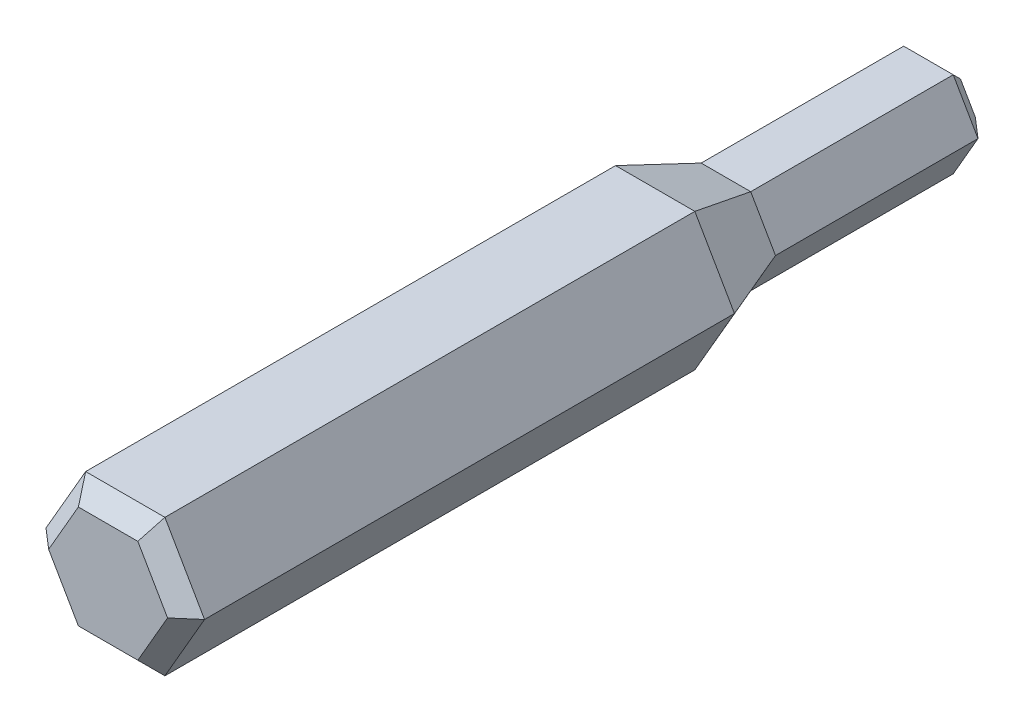
from build123d import *

# Parameters (mm, degrees)
EXTRUDE_1_DEPTH  = 18
CHAMFER_1_SIZE   = 0.5
EXTRUDE_2_DEPTH  = 6.4
CHAMFER_3_SIZE   = 0.75
CHAMFER_3_SIZE_2 = 2.060608065
CHAMFER_4_SIZE   = 0.5


with BuildPart() as part:
    # 草图1 → 凸台-拉伸1 (new body)
    with BuildSketch(Plane.XY):
        Polygon((2.309401077, 0), (1.154700538, 2), (-1.154700538, 2), (-2.309401077, 0), (-1.154700538, -2), (1.154700538, -2), align=None)
    extrude(amount=EXTRUDE_1_DEPTH)

    # 倒角1
    chamfer_1_edges = [part.edges().sort_by_distance(p)[0] for p in [
        (0, 2, 18),
        (-1.732050808, 1, 18),
        (-1.732050808, -1, 18),
        (0, -2, 18),
        (1.732050808, -1, 18),
        (1.732050808, 1, 18),
    ]]
    chamfer(chamfer_1_edges, length=CHAMFER_1_SIZE)

    # 草图2 → 凸台-拉伸2 (add)
    with BuildSketch(Plane(origin=(0, 0, 0), x_dir=(-1, 0, 0), z_dir=(0, 0, -1))):
        Polygon((1.443375673, 0), (0.721687836, 1.25), (-0.721687836, 1.25), (-1.443375673, 0), (-0.721687836, -1.25), (0.721687836, -1.25), align=None)
    extrude(amount=EXTRUDE_2_DEPTH)

    # 倒角3
    # the kernel refuses this chamfer: 2.060608065, 0.75 mm, written as the material it takes off along each edge
    with BuildSketch(Plane(origin=(-6.500319125, -2, 0), x_dir=(-1.0524294974817634e-14, 0.9950833631817486, -0.09904090225205059), z_dir=(1, 0, 0))) as chamfer_3_piece_1_section:
        Polygon((CHAMFER_3_SIZE * 0.995083363182, CHAMFER_3_SIZE * 0.0990409022521), (-CHAMFER_3_SIZE_2 * 0.0990409022324, CHAMFER_3_SIZE_2 * 0.995083362984), (0, 0), align=None)
    chamfer_3_piece_1 = extrude(amount=13.000638251, mode=Mode.PRIVATE)
    chamfer_3_piece_1 = split(chamfer_3_piece_1, bisect_by=Plane(origin=(-1.179179606, -0.457601011, 0.71229118), z_dir=(-0.8660254037844392, -0.4999999999999994, 0)), keep=Keep.TOP, mode=Mode.PRIVATE)
    chamfer_3_piece_1 = split(chamfer_3_piece_1, bisect_by=Plane(origin=(-3.459667972, -1.25, 0.71229118), z_dir=(0, -1, 0)), keep=Keep.TOP, mode=Mode.PRIVATE)
    add(chamfer_3_piece_1, mode=Mode.SUBTRACT)
    with BuildSketch(Plane(origin=(-6.500319125, -2, 0), x_dir=(-1.0524294974817634e-14, 0.9950833631817486, -0.09904090225205059), z_dir=(1, 0, 0))) as chamfer_3_piece_2_section:
        Polygon((CHAMFER_3_SIZE * 0.995083363182, CHAMFER_3_SIZE * 0.0990409022521), (-CHAMFER_3_SIZE_2 * 0.0990409022324, CHAMFER_3_SIZE_2 * 0.995083362984), (0, 0), align=None)
    chamfer_3_piece_2 = extrude(amount=13.000638251, mode=Mode.PRIVATE)
    chamfer_3_piece_2 = split(chamfer_3_piece_2, bisect_by=Plane(origin=(-0.338481018, -1.91373368, 0.629088335), z_dir=(0.8660254037844392, 0.4999999999999994, 0)), keep=Keep.TOP, mode=Mode.PRIVATE)
    chamfer_3_piece_2 = split(chamfer_3_piece_2, bisect_by=Plane(origin=(0, -1.25, 0.629088335), z_dir=(0, -1, 0)), keep=Keep.TOP, mode=Mode.PRIVATE)
    chamfer_3_piece_2 = split(chamfer_3_piece_2, bisect_by=Plane(origin=(0.338481018, -1.91373368, 0.629088335), z_dir=(-0.8660254037844385, 0.5000000000000003, 0)), keep=Keep.TOP, mode=Mode.PRIVATE)
    add(chamfer_3_piece_2, mode=Mode.SUBTRACT)
    with BuildSketch(Plane(origin=(-6.500319125, -2, 0), x_dir=(-1.0524294974817634e-14, 0.9950833631817486, -0.09904090225205059), z_dir=(1, 0, 0))) as chamfer_3_piece_3_section:
        Polygon((CHAMFER_3_SIZE * 0.995083363182, CHAMFER_3_SIZE * 0.0990409022521), (-CHAMFER_3_SIZE_2 * 0.0990409022324, CHAMFER_3_SIZE_2 * 0.995083362984), (0, 0), align=None)
    chamfer_3_piece_3 = extrude(amount=13.000638251, mode=Mode.PRIVATE)
    chamfer_3_piece_3 = split(chamfer_3_piece_3, bisect_by=Plane(origin=(3.459667972, -1.25, 0.71229118), z_dir=(0, -1, 0)), keep=Keep.TOP, mode=Mode.PRIVATE)
    chamfer_3_piece_3 = split(chamfer_3_piece_3, bisect_by=Plane(origin=(1.179179606, -0.457601011, 0.71229118), z_dir=(0.8660254037844385, -0.5000000000000003, 0)), keep=Keep.TOP, mode=Mode.PRIVATE)
    add(chamfer_3_piece_3, mode=Mode.SUBTRACT)
    with BuildSketch(Plane(origin=(-4.98221037, 4.629441495, 0), x_dir=(0.8617674713986471, 0.49754168159088125, -0.09904090225205053), z_dir=(0.500000000000007, -0.8660254037844347, 0))) as chamfer_3_piece_4_section:
        Polygon((CHAMFER_3_SIZE * 0.995083363182, CHAMFER_3_SIZE * 0.0990409022521), (-CHAMFER_3_SIZE_2 * 0.0990409022324, CHAMFER_3_SIZE_2 * 0.995083362984), (0, 0), align=None)
    chamfer_3_piece_4 = extrude(amount=13.000638251, mode=Mode.PRIVATE)
    chamfer_3_piece_4 = split(chamfer_3_piece_4, bisect_by=Plane(origin=(-2.812365741, 2.371160352, 0.71229118), z_dir=(-0.8660254037844392, -0.4999999999999994, 0)), keep=Keep.TOP, mode=Mode.PRIVATE)
    chamfer_3_piece_4 = split(chamfer_3_piece_4, bisect_by=Plane(origin=(-0.985883903, 0.792398989, 0.71229118), z_dir=(-0.8660254037844387, 0.5000000000000003, 0)), keep=Keep.TOP, mode=Mode.PRIVATE)
    add(chamfer_3_piece_4, mode=Mode.SUBTRACT)
    with BuildSketch(Plane(origin=(-4.98221037, 4.629441495, 0), x_dir=(0.8617674713986471, 0.49754168159088125, -0.09904090225205053), z_dir=(0.500000000000007, -0.8660254037844347, 0))) as chamfer_3_piece_5_section:
        Polygon((CHAMFER_3_SIZE * 0.995083363182, CHAMFER_3_SIZE * 0.0990409022521), (-CHAMFER_3_SIZE_2 * 0.0990409022324, CHAMFER_3_SIZE_2 * 0.995083362984), (0, 0), align=None)
    chamfer_3_piece_5 = extrude(amount=13.000638251, mode=Mode.PRIVATE)
    chamfer_3_piece_5 = split(chamfer_3_piece_5, bisect_by=Plane(origin=(-1.082531755, -0.625, 0.629088335), z_dir=(-0.8660254037844392, -0.4999999999999994, 0)), keep=Keep.TOP, mode=Mode.PRIVATE)
    chamfer_3_piece_5 = split(chamfer_3_piece_5, bisect_by=Plane(origin=(-1.488101474, -1.25, 0.629088335), z_dir=(0, 1, 0)), keep=Keep.TOP, mode=Mode.PRIVATE)
    chamfer_3_piece_5 = split(chamfer_3_piece_5, bisect_by=Plane(origin=(-1.826582492, -0.66373368, 0.629088335), z_dir=(0.8660254037844387, -0.5000000000000003, 0)), keep=Keep.TOP, mode=Mode.PRIVATE)
    add(chamfer_3_piece_5, mode=Mode.SUBTRACT)
    with BuildSketch(Plane(origin=(-4.98221037, 4.629441495, 0), x_dir=(0.8617674713986471, 0.49754168159088125, -0.09904090225205053), z_dir=(0.500000000000007, -0.8660254037844347, 0))) as chamfer_3_piece_6_section:
        Polygon((CHAMFER_3_SIZE * 0.995083363182, CHAMFER_3_SIZE * 0.0990409022521), (-CHAMFER_3_SIZE_2 * 0.0990409022324, CHAMFER_3_SIZE_2 * 0.995083362984), (0, 0), align=None)
    chamfer_3_piece_6 = extrude(amount=13.000638251, mode=Mode.PRIVATE)
    chamfer_3_piece_6 = split(chamfer_3_piece_6, bisect_by=Plane(origin=(0.647302231, -3.621160352, 0.71229118), z_dir=(-0.8660254037844392, -0.4999999999999994, 0)), keep=Keep.TOP, mode=Mode.PRIVATE)
    chamfer_3_piece_6 = split(chamfer_3_piece_6, bisect_by=Plane(origin=(0.193295703, -1.25, 0.71229118), z_dir=(0, -1, 0)), keep=Keep.TOP, mode=Mode.PRIVATE)
    add(chamfer_3_piece_6, mode=Mode.SUBTRACT)
    with BuildSketch(Plane(origin=(1.518108755, 6.629441495, 0), x_dir=(0.861767471398654, -0.4975416815908692, -0.09904090225205063), z_dir=(-0.4999999999999949, -0.8660254037844416, 0))) as chamfer_3_piece_7_section:
        Polygon((CHAMFER_3_SIZE * 0.995083363182, CHAMFER_3_SIZE * 0.0990409022521), (-CHAMFER_3_SIZE_2 * 0.0990409022324, CHAMFER_3_SIZE_2 * 0.995083362984), (0, 0), align=None)
    chamfer_3_piece_7 = extrude(amount=13.000638251, mode=Mode.PRIVATE)
    chamfer_3_piece_7 = split(chamfer_3_piece_7, bisect_by=Plane(origin=(0.193295703, 1.25, 0.71229118), z_dir=(0, 1, 0)), keep=Keep.TOP, mode=Mode.PRIVATE)
    chamfer_3_piece_7 = split(chamfer_3_piece_7, bisect_by=Plane(origin=(0.647302231, 3.621160352, 0.71229118), z_dir=(-0.8660254037844387, 0.5000000000000003, 0)), keep=Keep.TOP, mode=Mode.PRIVATE)
    add(chamfer_3_piece_7, mode=Mode.SUBTRACT)
    with BuildSketch(Plane(origin=(1.518108755, 6.629441495, 0), x_dir=(0.861767471398654, -0.4975416815908692, -0.09904090225205063), z_dir=(-0.4999999999999949, -0.8660254037844416, 0))) as chamfer_3_piece_8_section:
        Polygon((CHAMFER_3_SIZE * 0.995083363182, CHAMFER_3_SIZE * 0.0990409022521), (-CHAMFER_3_SIZE_2 * 0.0990409022324, CHAMFER_3_SIZE_2 * 0.995083362984), (0, 0), align=None)
    chamfer_3_piece_8 = extrude(amount=13.000638251, mode=Mode.PRIVATE)
    chamfer_3_piece_8 = split(chamfer_3_piece_8, bisect_by=Plane(origin=(-1.826582492, 0.66373368, 0.629088335), z_dir=(0.8660254037844392, 0.4999999999999994, 0)), keep=Keep.TOP, mode=Mode.PRIVATE)
    chamfer_3_piece_8 = split(chamfer_3_piece_8, bisect_by=Plane(origin=(-1.488101474, 1.25, 0.629088335), z_dir=(0, -1, 0)), keep=Keep.TOP, mode=Mode.PRIVATE)
    chamfer_3_piece_8 = split(chamfer_3_piece_8, bisect_by=Plane(origin=(-1.082531755, 0.625, 0.629088335), z_dir=(-0.8660254037844387, 0.5000000000000003, 0)), keep=Keep.TOP, mode=Mode.PRIVATE)
    add(chamfer_3_piece_8, mode=Mode.SUBTRACT)
    with BuildSketch(Plane(origin=(1.518108755, 6.629441495, 0), x_dir=(0.861767471398654, -0.4975416815908692, -0.09904090225205063), z_dir=(-0.4999999999999949, -0.8660254037844416, 0))) as chamfer_3_piece_9_section:
        Polygon((CHAMFER_3_SIZE * 0.995083363182, CHAMFER_3_SIZE * 0.0990409022521), (-CHAMFER_3_SIZE_2 * 0.0990409022324, CHAMFER_3_SIZE_2 * 0.995083362984), (0, 0), align=None)
    chamfer_3_piece_9 = extrude(amount=13.000638251, mode=Mode.PRIVATE)
    chamfer_3_piece_9 = split(chamfer_3_piece_9, bisect_by=Plane(origin=(-0.985883903, -0.792398989, 0.71229118), z_dir=(-0.8660254037844392, -0.4999999999999994, 0)), keep=Keep.TOP, mode=Mode.PRIVATE)
    chamfer_3_piece_9 = split(chamfer_3_piece_9, bisect_by=Plane(origin=(-2.812365741, -2.371160352, 0.71229118), z_dir=(-0.8660254037844387, 0.5000000000000003, 0)), keep=Keep.TOP, mode=Mode.PRIVATE)
    add(chamfer_3_piece_9, mode=Mode.SUBTRACT)
    with BuildSketch(Plane(origin=(6.500319125, 2, 0), x_dir=(3.5399901278932047e-15, -0.9950833631817486, -0.09904090225205059), z_dir=(-1, 0, 0))) as chamfer_3_piece_10_section:
        Polygon((CHAMFER_3_SIZE * 0.995083363182, CHAMFER_3_SIZE * 0.0990409022521), (-CHAMFER_3_SIZE_2 * 0.0990409022324, CHAMFER_3_SIZE_2 * 0.995083362984), (0, 0), align=None)
    chamfer_3_piece_10 = extrude(amount=13.000638251, mode=Mode.PRIVATE)
    chamfer_3_piece_10 = split(chamfer_3_piece_10, bisect_by=Plane(origin=(1.179179606, 0.457601011, 0.71229118), z_dir=(0.8660254037844389, 0.4999999999999995, 0)), keep=Keep.TOP, mode=Mode.PRIVATE)
    chamfer_3_piece_10 = split(chamfer_3_piece_10, bisect_by=Plane(origin=(3.459667972, 1.25, 0.71229118), z_dir=(0, 1, 0)), keep=Keep.TOP, mode=Mode.PRIVATE)
    add(chamfer_3_piece_10, mode=Mode.SUBTRACT)
    with BuildSketch(Plane(origin=(6.500319125, 2, 0), x_dir=(3.5399901278932047e-15, -0.9950833631817486, -0.09904090225205059), z_dir=(-1, 0, 0))) as chamfer_3_piece_11_section:
        Polygon((CHAMFER_3_SIZE * 0.995083363182, CHAMFER_3_SIZE * 0.0990409022521), (-CHAMFER_3_SIZE_2 * 0.0990409022324, CHAMFER_3_SIZE_2 * 0.995083362984), (0, 0), align=None)
    chamfer_3_piece_11 = extrude(amount=13.000638251, mode=Mode.PRIVATE)
    chamfer_3_piece_11 = split(chamfer_3_piece_11, bisect_by=Plane(origin=(0.338481018, 1.91373368, 0.629088335), z_dir=(-0.8660254037844389, -0.4999999999999995, 0)), keep=Keep.TOP, mode=Mode.PRIVATE)
    chamfer_3_piece_11 = split(chamfer_3_piece_11, bisect_by=Plane(origin=(0, 1.25, 0.629088335), z_dir=(0, 1, 0)), keep=Keep.TOP, mode=Mode.PRIVATE)
    chamfer_3_piece_11 = split(chamfer_3_piece_11, bisect_by=Plane(origin=(-0.338481018, 1.91373368, 0.629088335), z_dir=(0.8660254037844387, -0.5000000000000003, 0)), keep=Keep.TOP, mode=Mode.PRIVATE)
    add(chamfer_3_piece_11, mode=Mode.SUBTRACT)
    with BuildSketch(Plane(origin=(6.500319125, 2, 0), x_dir=(3.5399901278932047e-15, -0.9950833631817486, -0.09904090225205059), z_dir=(-1, 0, 0))) as chamfer_3_piece_12_section:
        Polygon((CHAMFER_3_SIZE * 0.995083363182, CHAMFER_3_SIZE * 0.0990409022521), (-CHAMFER_3_SIZE_2 * 0.0990409022324, CHAMFER_3_SIZE_2 * 0.995083362984), (0, 0), align=None)
    chamfer_3_piece_12 = extrude(amount=13.000638251, mode=Mode.PRIVATE)
    chamfer_3_piece_12 = split(chamfer_3_piece_12, bisect_by=Plane(origin=(-3.459667972, 1.25, 0.71229118), z_dir=(0, 1, 0)), keep=Keep.TOP, mode=Mode.PRIVATE)
    chamfer_3_piece_12 = split(chamfer_3_piece_12, bisect_by=Plane(origin=(-1.179179606, 0.457601011, 0.71229118), z_dir=(-0.8660254037844387, 0.5000000000000003, 0)), keep=Keep.TOP, mode=Mode.PRIVATE)
    add(chamfer_3_piece_12, mode=Mode.SUBTRACT)
    with BuildSketch(Plane(origin=(4.98221037, -4.629441495, 0), x_dir=(0.011417729324999642, 0.006592029099322844, 0.9999130865277316), z_dir=(-0.500000000000001, 0.866025403784438, 0))) as chamfer_3_piece_13_section:
        Polygon((CHAMFER_3_SIZE_2 * 0.999913086329, -CHAMFER_3_SIZE_2 * 0.013184058196), (-CHAMFER_3_SIZE * 0.0131840581986, -CHAMFER_3_SIZE * 0.999913086528), (0, 0), align=None)
    chamfer_3_piece_13 = extrude(amount=13.000638251, mode=Mode.PRIVATE)
    chamfer_3_piece_13 = split(chamfer_3_piece_13, bisect_by=Plane(origin=(0.985883903, -0.792398989, 0.71229118), z_dir=(0.8660254037844385, -0.5000000000000003, 0)), keep=Keep.TOP, mode=Mode.PRIVATE)
    chamfer_3_piece_13 = split(chamfer_3_piece_13, bisect_by=Plane(origin=(2.812365741, -2.371160352, 0.71229118), z_dir=(0.8660254037844389, 0.4999999999999995, 0)), keep=Keep.TOP, mode=Mode.PRIVATE)
    add(chamfer_3_piece_13, mode=Mode.SUBTRACT)
    with BuildSketch(Plane(origin=(4.98221037, -4.629441495, 0), x_dir=(0.011417729324999642, 0.006592029099322844, 0.9999130865277316), z_dir=(-0.500000000000001, 0.866025403784438, 0))) as chamfer_3_piece_14_section:
        Polygon((CHAMFER_3_SIZE_2 * 0.999913086329, -CHAMFER_3_SIZE_2 * 0.013184058196), (-CHAMFER_3_SIZE * 0.0131840581986, -CHAMFER_3_SIZE * 0.999913086528), (0, 0), align=None)
    chamfer_3_piece_14 = extrude(amount=13.000638251, mode=Mode.PRIVATE)
    chamfer_3_piece_14 = split(chamfer_3_piece_14, bisect_by=Plane(origin=(1.826582492, 0.66373368, 0.629088335), z_dir=(-0.8660254037844385, 0.5000000000000003, 0)), keep=Keep.TOP, mode=Mode.PRIVATE)
    chamfer_3_piece_14 = split(chamfer_3_piece_14, bisect_by=Plane(origin=(1.082531755, 0.625, 0.629088335), z_dir=(0.8660254037844389, 0.4999999999999995, 0)), keep=Keep.TOP, mode=Mode.PRIVATE)
    chamfer_3_piece_14 = split(chamfer_3_piece_14, bisect_by=Plane(origin=(1.488101474, 1.25, 0.629088335), z_dir=(0, -1, 0)), keep=Keep.TOP, mode=Mode.PRIVATE)
    add(chamfer_3_piece_14, mode=Mode.SUBTRACT)
    with BuildSketch(Plane(origin=(4.98221037, -4.629441495, 0), x_dir=(0.011417729324999642, 0.006592029099322844, 0.9999130865277316), z_dir=(-0.500000000000001, 0.866025403784438, 0))) as chamfer_3_piece_15_section:
        Polygon((CHAMFER_3_SIZE_2 * 0.999913086329, -CHAMFER_3_SIZE_2 * 0.013184058196), (-CHAMFER_3_SIZE * 0.0131840581986, -CHAMFER_3_SIZE * 0.999913086528), (0, 0), align=None)
    chamfer_3_piece_15 = extrude(amount=13.000638251, mode=Mode.PRIVATE)
    chamfer_3_piece_15 = split(chamfer_3_piece_15, bisect_by=Plane(origin=(-0.647302231, 3.621160352, 0.71229118), z_dir=(0.8660254037844389, 0.4999999999999995, 0)), keep=Keep.TOP, mode=Mode.PRIVATE)
    chamfer_3_piece_15 = split(chamfer_3_piece_15, bisect_by=Plane(origin=(-0.193295703, 1.25, 0.71229118), z_dir=(0, 1, 0)), keep=Keep.TOP, mode=Mode.PRIVATE)
    add(chamfer_3_piece_15, mode=Mode.SUBTRACT)
    with BuildSketch(Plane(origin=(-1.518108755, -6.629441495, 0), x_dir=(0.011417729324999607, -0.006592029099322722, 0.9999130865277316), z_dir=(0.4999999999999951, 0.8660254037844415, 0))) as chamfer_3_piece_16_section:
        Polygon((CHAMFER_3_SIZE_2 * 0.999913086329, -CHAMFER_3_SIZE_2 * 0.013184058196), (-CHAMFER_3_SIZE * 0.0131840581986, -CHAMFER_3_SIZE * 0.999913086528), (0, 0), align=None)
    chamfer_3_piece_16 = extrude(amount=13.000638251, mode=Mode.PRIVATE)
    chamfer_3_piece_16 = split(chamfer_3_piece_16, bisect_by=Plane(origin=(-0.193295703, -1.25, 0.71229118), z_dir=(0, -1, 0)), keep=Keep.TOP, mode=Mode.PRIVATE)
    chamfer_3_piece_16 = split(chamfer_3_piece_16, bisect_by=Plane(origin=(-0.647302231, -3.621160352, 0.71229118), z_dir=(0.8660254037844385, -0.5000000000000003, 0)), keep=Keep.TOP, mode=Mode.PRIVATE)
    add(chamfer_3_piece_16, mode=Mode.SUBTRACT)
    with BuildSketch(Plane(origin=(-1.518108755, -6.629441495, 0), x_dir=(0.011417729324999607, -0.006592029099322722, 0.9999130865277316), z_dir=(0.4999999999999951, 0.8660254037844415, 0))) as chamfer_3_piece_17_section:
        Polygon((CHAMFER_3_SIZE_2 * 0.999913086329, -CHAMFER_3_SIZE_2 * 0.013184058196), (-CHAMFER_3_SIZE * 0.0131840581986, -CHAMFER_3_SIZE * 0.999913086528), (0, 0), align=None)
    chamfer_3_piece_17 = extrude(amount=13.000638251, mode=Mode.PRIVATE)
    chamfer_3_piece_17 = split(chamfer_3_piece_17, bisect_by=Plane(origin=(1.488101474, -1.25, 0.629088335), z_dir=(0, 1, 0)), keep=Keep.TOP, mode=Mode.PRIVATE)
    chamfer_3_piece_17 = split(chamfer_3_piece_17, bisect_by=Plane(origin=(1.082531755, -0.625, 0.629088335), z_dir=(0.8660254037844385, -0.5000000000000003, 0)), keep=Keep.TOP, mode=Mode.PRIVATE)
    chamfer_3_piece_17 = split(chamfer_3_piece_17, bisect_by=Plane(origin=(1.826582492, -0.66373368, 0.629088335), z_dir=(-0.8660254037844389, -0.4999999999999995, 0)), keep=Keep.TOP, mode=Mode.PRIVATE)
    add(chamfer_3_piece_17, mode=Mode.SUBTRACT)
    with BuildSketch(Plane(origin=(-1.518108755, -6.629441495, 0), x_dir=(0.011417729324999607, -0.006592029099322722, 0.9999130865277316), z_dir=(0.4999999999999951, 0.8660254037844415, 0))) as chamfer_3_piece_18_section:
        Polygon((CHAMFER_3_SIZE_2 * 0.999913086329, -CHAMFER_3_SIZE_2 * 0.013184058196), (-CHAMFER_3_SIZE * 0.0131840581986, -CHAMFER_3_SIZE * 0.999913086528), (0, 0), align=None)
    chamfer_3_piece_18 = extrude(amount=13.000638251, mode=Mode.PRIVATE)
    chamfer_3_piece_18 = split(chamfer_3_piece_18, bisect_by=Plane(origin=(2.812365741, 2.371160352, 0.71229118), z_dir=(0.8660254037844385, -0.5000000000000003, 0)), keep=Keep.TOP, mode=Mode.PRIVATE)
    chamfer_3_piece_18 = split(chamfer_3_piece_18, bisect_by=Plane(origin=(0.985883903, 0.792398989, 0.71229118), z_dir=(0.8660254037844389, 0.4999999999999995, 0)), keep=Keep.TOP, mode=Mode.PRIVATE)
    add(chamfer_3_piece_18, mode=Mode.SUBTRACT)

    # 倒角4
    chamfer_4_edges = [part.edges().sort_by_distance(p)[0] for p in [
        (-1.082531755, -0.625, -6.4),
        (-1.082531755, 0.625, -6.4),
        (0, 1.25, -6.4),
        (1.082531755, 0.625, -6.4),
        (1.082531755, -0.625, -6.4),
        (0, -1.25, -6.4),
    ]]
    chamfer(chamfer_4_edges, length=CHAMFER_4_SIZE)


solid = part.part
